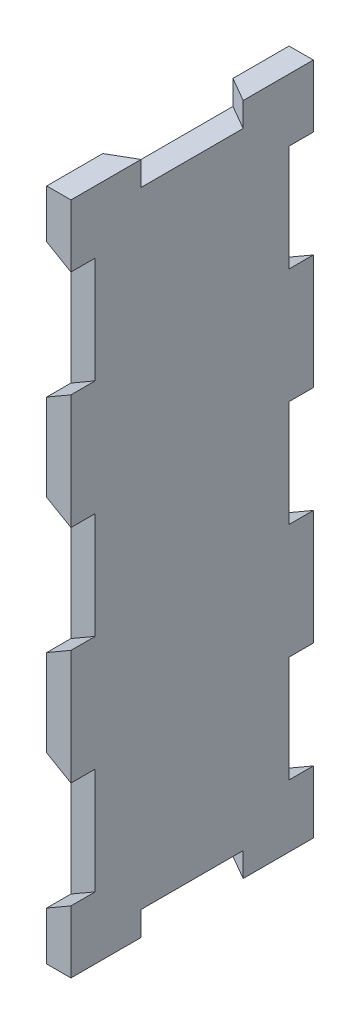
from build123d import *

# Parameters (mm, degrees)
SKETCH2_W           = 139
SKETCH2_H           = 50
BOSS_EXTRUDE1_DEPTH = 5
CUT_EXTRUDE1_DEPTH  = 5
CUT_EXTRUDE2_START  = -45
CUT_EXTRUDE2_DEPTH  = 5
CUT_EXTRUDE3_DEPTH  = 5
CUT_EXTRUDE5_START  = -134
CUT_EXTRUDE5_DEPTH  = 5


with BuildPart() as part:
    # Sketch2 → Boss-Extrude1 (new body)
    with BuildSketch(Plane.YZ):
        Rectangle(SKETCH2_W, SKETCH2_H)
    extrude(amount=BOSS_EXTRUDE1_DEPTH)

    # Sketch3 → Cut-Extrude1 (cut)
    with BuildSketch(Plane(origin=(0, 0, -25), x_dir=(1, 0, 0), z_dir=(0, 0, -1))):
        Polygon((0, 31.787187079), (0, 59.5), (24, 45.643593539), align=None)
        Polygon((0, -13.856406461), (0, 13.856406461), (24, 0), align=None)
        Polygon((0, -59.5), (0, -31.787187079), (24, -45.643593539), align=None)
    extrude(amount=-CUT_EXTRUDE1_DEPTH, mode=Mode.SUBTRACT)

    # Sketch3<3> → Cut-Extrude2 (cut)
    with BuildSketch(Plane(origin=(0, 0, -25), x_dir=(1, 0, 0), z_dir=(0, 0, -1)).offset(CUT_EXTRUDE2_START)):
        Polygon((0, 31.787187079), (0, 59.5), (24, 45.643593539), align=None)
        Polygon((0, -13.856406461), (0, 13.856406461), (24, 0), align=None)
        Polygon((0, -59.5), (0, -31.787187079), (24, -45.643593539), align=None)
    extrude(amount=-CUT_EXTRUDE2_DEPTH, mode=Mode.SUBTRACT)

    # Sketch6 → Cut-Extrude3 (cut)
    with BuildSketch(Plane(origin=(0, 69.5, 0), x_dir=(-1, 0, 0), z_dir=(0, 1, 0))):
        Polygon((0, 13.423393759), (0, -13.423393759), (-23.25, 0), align=None)
    extrude(amount=-CUT_EXTRUDE3_DEPTH, mode=Mode.SUBTRACT)

    # Sketch6<3> → Cut-Extrude5 (cut)
    with BuildSketch(Plane(origin=(0, 69.5, 0), x_dir=(-1, 0, 0), z_dir=(0, 1, 0)).offset(CUT_EXTRUDE5_START)):
        Polygon((0, 13.423393759), (0, -13.423393759), (-23.25, 0), align=None)
    extrude(amount=-CUT_EXTRUDE5_DEPTH, mode=Mode.SUBTRACT)


solid = part.part
